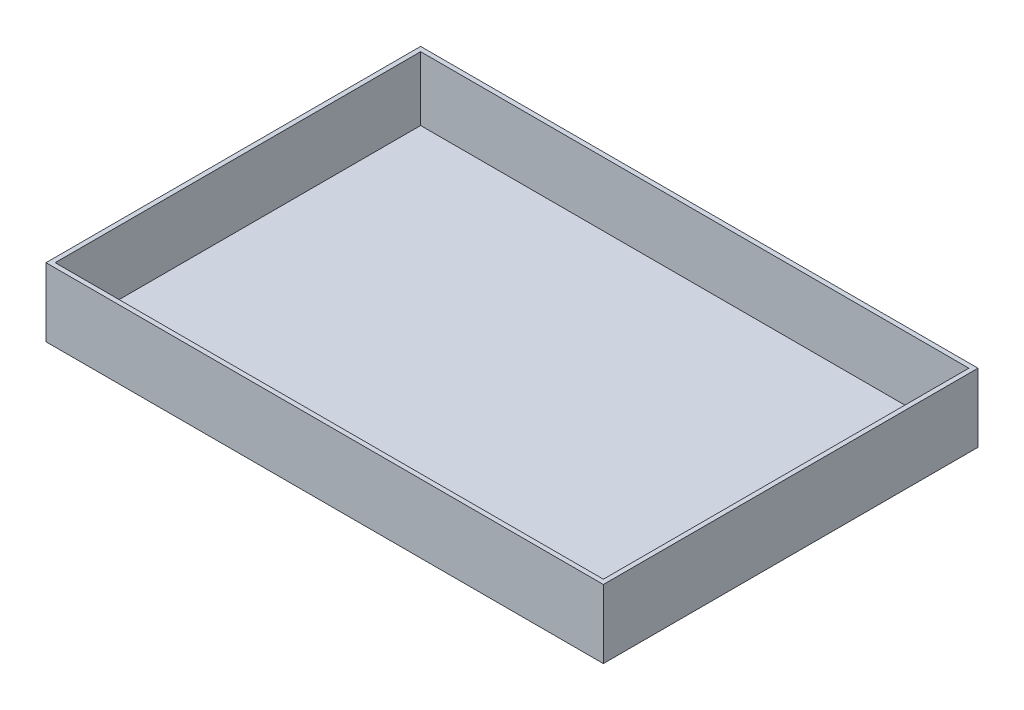
from build123d import *

# Parameters (mm, degrees)
SKETCH_1_W      = 610
SKETCH_1_H      = 410
EXTRUDE_1_DEPTH = 75
SHELL_1_T       = -5


with BuildPart() as part:
    # ｽｹｯﾁ1 → ﾎﾞｽ - 押し出し1 (new body)
    with BuildSketch(Plane(origin=(0, 0, 0), x_dir=(1, 0, 0), z_dir=(0, 1, 0))):
        Rectangle(SKETCH_1_W, SKETCH_1_H)
    extrude(amount=EXTRUDE_1_DEPTH)

    # ｼｪﾙ1
    shell_1_openings = [part.faces().sort_by_distance(p)[0] for p in [
        (0, 75, 0),
    ]]
    offset(amount=SHELL_1_T, openings=shell_1_openings, kind=Kind.INTERSECTION)


solid = part.part
